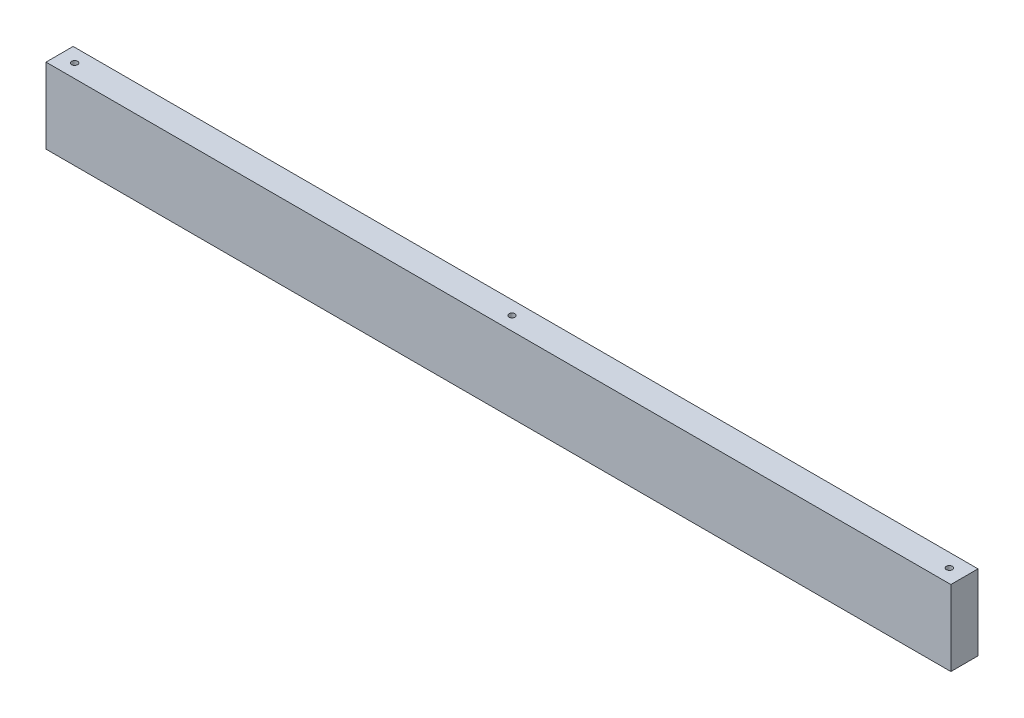
from build123d import *

# Parameters (mm, degrees)
SKETCH1_W           = 600
SKETCH1_H           = 50
BOSS_EXTRUDE1_DEPTH = 18
SKETCH2_R           = 2
CUT_EXTRUDE1_DEPTH  = 25


with BuildPart() as part:
    # Sketch1 → Boss-Extrude1 (new body)
    with BuildSketch(Plane.XY):
        Rectangle(SKETCH1_W, SKETCH1_H)
    extrude(amount=BOSS_EXTRUDE1_DEPTH)

    # Sketch2 → Cut-Extrude1 (cut)
    with BuildSketch(Plane(origin=(0, 25, 0), x_dir=(1, 0, 0), z_dir=(0, 1, 0))):
        with Locations((-290, -9)):
            Circle(SKETCH2_R)
        with Locations((0, -9)):
            Circle(SKETCH2_R)
        with Locations((290, -9)):
            Circle(SKETCH2_R)
    extrude(amount=-CUT_EXTRUDE1_DEPTH, mode=Mode.SUBTRACT)


solid = part.part
